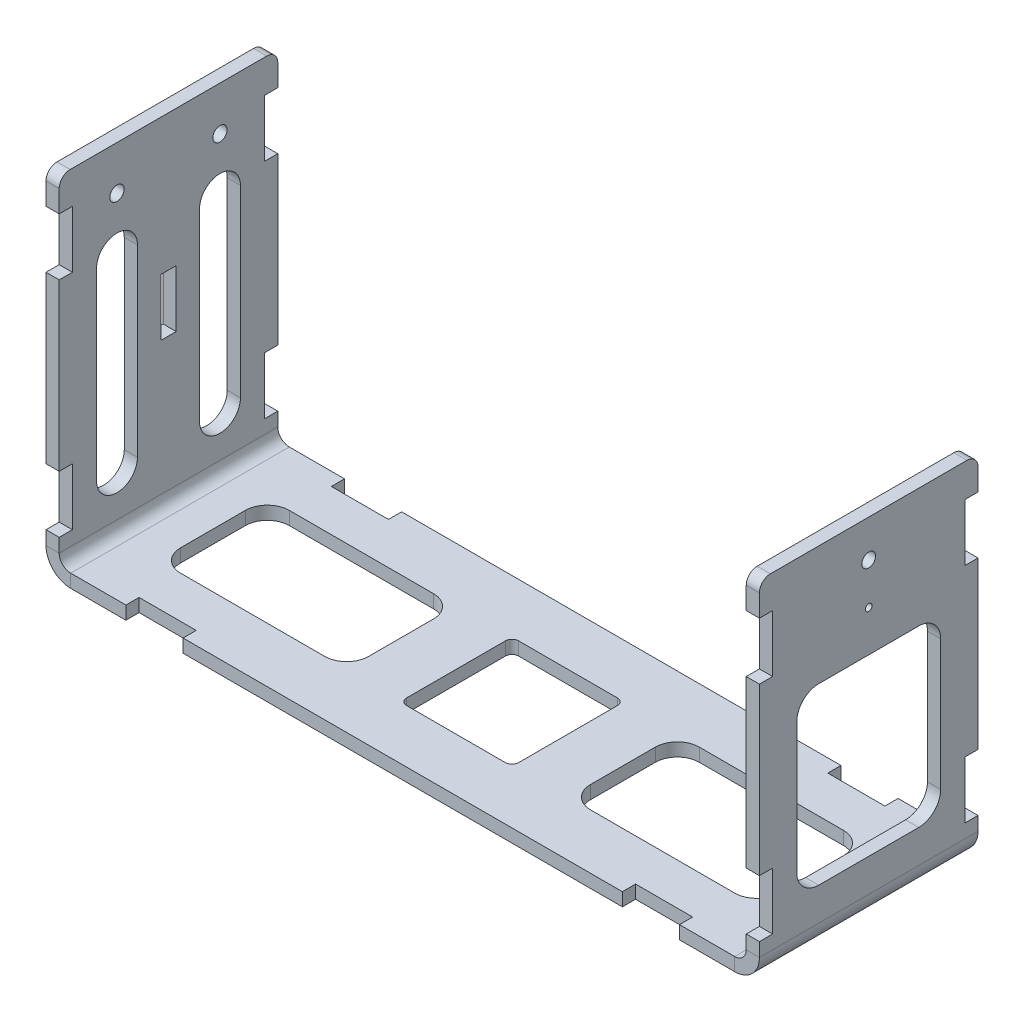
from build123d import *

# Parameters (mm, degrees)
BASE_FLANGE1_DEPTH      = 25.273
CUT_EXTRUDE1_DEPTH      = 117.462097169
CUT_EXTRUDE1_DEPTH_BACK = 117.462097169
SKETCH6_W               = 13.208
SKETCH6_H               = 3.048
CUT_EXTRUDE2_DEPTH      = 182.604935466
CUT_EXTRUDE2_DEPTH_BACK = 182.604935466
SKETCH7_W               = 3.048
SKETCH7_H               = 13.208
FILLET1_R               = 2.54
SKETCH9_R               = 1.5875
SKETCH9_R_2             = 0.7747
CUT_EXTRUDE4_DEPTH      = 182.604935466
CUT_EXTRUDE5_REACH      = 186.328
SKETCH10_R              = 1.651
CUT_EXTRUDE6_REACH      = 186.328
SKETCH11_W              = 3.556
SKETCH11_H              = 13.208
CUT_EXTRUDE8_REACH      = 120.531
SKETCH15_W              = 43.500088515
SKETCH15_H              = 25.146
FILLET2_R               = 5.08
CUT_EXTRUDE9_REACH      = 186.328
CUT_EXTRUDE12_REACH     = 186.328
SKETCH21_W              = 33.274
SKETCH21_H              = 40.343404573
FILLET4_R               = 5.08


# Sheet-metal steps are written as plain solids
with BuildPart() as part:
    # Sketch1 → Base-Flange1 (new, symmetric)
    with BuildSketch(Plane.XY):
        with BuildLine():
            Line((79.441088515, 78.232), (79.441088515, 2.667))
            ThreePointArc((79.441088515, 2.667), (78.6599423, 0.781146215), (76.774088515, 0))
            Line((76.774088515, 0), (-76.774088515, 0))
            ThreePointArc((-76.774088515, 0), (-78.6599423, 0.781146215), (-79.441088515, 2.667))
            Line((-79.441088515, 2.667), (-79.441088515, 78.232))
            Line((-79.441088515, 78.232), (-82.489088515, 78.232))
            Line((-82.489088515, 78.232), (-82.489088515, 2.667))
            ThreePointArc((-82.489088515, 2.667), (-80.815203769, -1.374115254), (-76.774088515, -3.048))
            Line((-76.774088515, -3.048), (76.774088515, -3.048))
            ThreePointArc((76.774088515, -3.048), (80.815203769, -1.374115254), (82.489088515, 2.667))
            Line((82.489088515, 2.667), (82.489088515, 78.232))
            Line((82.489088515, 78.232), (79.441088515, 78.232))
        make_face()
    extrude(amount=BASE_FLANGE1_DEPTH, both=True)

    # Sketch6 → Cut-Extrude1 (cut, two sides: drawn at the far end of the back side and taken through both)
    with BuildSketch(Plane(origin=(0, 0, 0), x_dir=(1, 0, 0), z_dir=(0, 1, 0)).offset(-CUT_EXTRUDE1_DEPTH_BACK)):
        with Locations((-57.404, 23.749)):
            Rectangle(SKETCH6_W, SKETCH6_H)
        with Locations((-57.404, -23.749)):
            Rectangle(SKETCH6_W, SKETCH6_H)
        with Locations((57.404, -23.749)):
            Rectangle(SKETCH6_W, SKETCH6_H)
        with Locations((57.404, 23.749)):
            Rectangle(SKETCH6_W, SKETCH6_H)
    extrude(amount=CUT_EXTRUDE1_DEPTH + CUT_EXTRUDE1_DEPTH_BACK, mode=Mode.SUBTRACT)

    # Sketch7 → Cut-Extrude2 (cut, two sides: drawn at the far end of the back side and taken through both)
    with BuildSketch(Plane(origin=(-79.441088515, 0, 0), x_dir=(0, 0, -1), z_dir=(1, 0, 0)).offset(-CUT_EXTRUDE2_DEPTH_BACK)):
        with Locations((-23.749, 12.446)):
            Rectangle(SKETCH7_W, SKETCH7_H)
        with Locations((23.749, 12.446)):
            Rectangle(SKETCH7_W, SKETCH7_H)
        with Locations((23.749, 64.008)):
            Rectangle(SKETCH7_W, SKETCH7_H)
        with Locations((-23.749, 64.008)):
            Rectangle(SKETCH7_W, SKETCH7_H)
    extrude(amount=CUT_EXTRUDE2_DEPTH + CUT_EXTRUDE2_DEPTH_BACK, mode=Mode.SUBTRACT)

    # Fillet1
    fillet1_edges = [part.edges().sort_by_distance(p)[0] for p in [
        (80.965088515, 78.232, -25.273),
        (-80.965088515, 78.232, -25.273),
        (80.965088515, 78.232, 25.273),
        (-80.965088515, 78.232, 25.273),
    ]]
    fillet(fillet1_edges, radius=FILLET1_R)

    # Sketch9 → Cut-Extrude4 (cut, through all)
    with BuildSketch(Plane.ZY.offset(-79.441088515)):
        with Locations(Location((0, 69.638595427, 0), (0, 0, 270))):
            Circle(SKETCH9_R)
        with Locations(Location((0, 60.113595427, 0), (0, 0, 270))):
            Circle(SKETCH9_R_2)
    extrude(amount=-CUT_EXTRUDE4_DEPTH, mode=Mode.SUBTRACT)

    # Sketch10 → Cut-Extrude5 (cut, up to next)
    with BuildSketch(Plane.ZY.offset(82.489088515), mode=Mode.PRIVATE) as cut_extrude5_sk1:
        with Locations(Location((11.90625, 68.072, 0), (0, 0, 270))):
            Circle(SKETCH10_R)
    cut_extrude5_tool1 = extrude(cut_extrude5_sk1.sketch, amount=-CUT_EXTRUDE5_REACH, mode=Mode.PRIVATE) & part.part
    # Sketch10 → Cut-Extrude5 (cut, up to next)
    with BuildSketch(Plane.ZY.offset(82.489088515), mode=Mode.PRIVATE) as cut_extrude5_sk2:
        with Locations(Location((-11.90625, 68.072, 0), (0, 0, 270))):
            Circle(SKETCH10_R)
    cut_extrude5_tool2 = extrude(cut_extrude5_sk2.sketch, amount=-CUT_EXTRUDE5_REACH, mode=Mode.PRIVATE) & part.part
    add(cut_extrude5_tool1.solids().sort_by_distance((-82.489089, 68.072, 11.90625))[0], mode=Mode.SUBTRACT)
    add(cut_extrude5_tool2.solids().sort_by_distance((-82.489089, 68.072, -11.90625))[0], mode=Mode.SUBTRACT)

    # Sketch11 → Cut-Extrude6 (cut, up to next)
    with BuildSketch(Plane.ZY.offset(82.489088515), mode=Mode.PRIVATE) as cut_extrude6_sk1:
        with Locations((0, 40.132)):
            Rectangle(SKETCH11_W, SKETCH11_H)
    cut_extrude6_tool1 = extrude(cut_extrude6_sk1.sketch, amount=-CUT_EXTRUDE6_REACH, mode=Mode.PRIVATE) & part.part
    add(cut_extrude6_tool1.solids().sort_by_distance((-82.489089, 40.132, 0))[0], mode=Mode.SUBTRACT)

    # Sketch15 → Cut-Extrude8 (cut, up to next)
    with BuildSketch(Plane.XZ.offset(3.048), mode=Mode.PRIVATE) as cut_extrude8_sk1:
        with Locations((-47.404044257, 0)):
            Rectangle(SKETCH15_W, SKETCH15_H)
    cut_extrude8_tool1 = extrude(cut_extrude8_sk1.sketch, amount=-CUT_EXTRUDE8_REACH, mode=Mode.PRIVATE) & part.part
    # Sketch15 → Cut-Extrude8 (cut, up to next)
    with BuildSketch(Plane.XZ.offset(3.048), mode=Mode.PRIVATE) as cut_extrude8_sk2:
        with Locations((47.404044257, 0)):
            Rectangle(SKETCH15_W, SKETCH15_H)
    cut_extrude8_tool2 = extrude(cut_extrude8_sk2.sketch, amount=-CUT_EXTRUDE8_REACH, mode=Mode.PRIVATE) & part.part
    # Sketch15 → Cut-Extrude8 (cut, up to next)
    with BuildSketch(Plane.XZ.offset(3.048), mode=Mode.PRIVATE) as cut_extrude8_sk3:
        with BuildLine():
            Line((12.954, -11.43), (12.954, 11.43))
            ThreePointArc((12.954, 11.43), (12.507630735, 12.507630735), (11.43, 12.954))
            Line((11.43, 12.954), (-11.43, 12.954))
            ThreePointArc((-11.43, 12.954), (-12.507630735, 12.507630735), (-12.954, 11.43))
            Line((-12.954, 11.43), (-12.954, -11.43))
            ThreePointArc((-12.954, -11.43), (-12.507630735, -12.507630735), (-11.43, -12.954))
            Line((-11.43, -12.954), (11.43, -12.954))
            ThreePointArc((11.43, -12.954), (12.507630735, -12.507630735), (12.954, -11.43))
        make_face()
    cut_extrude8_tool3 = extrude(cut_extrude8_sk3.sketch, amount=-CUT_EXTRUDE8_REACH, mode=Mode.PRIVATE) & part.part
    add(cut_extrude8_tool1.solids().sort_by_distance((-47.404044, -3.048, 0))[0], mode=Mode.SUBTRACT)
    add(cut_extrude8_tool2.solids().sort_by_distance((47.404044, -3.048, 0))[0], mode=Mode.SUBTRACT)
    add(cut_extrude8_tool3.solids().sort_by_distance((0, -3.048, 0))[0], mode=Mode.SUBTRACT)

    # Fillet2
    fillet2_edges = [part.edges().sort_by_distance(p)[0] for p in [
        (-69.154088515, -1.524, -12.573),
        (-69.154088515, -1.524, 12.573),
        (-25.654, -1.524, 12.573),
        (-25.654, -1.524, -12.573),
        (25.654, -1.524, 12.573),
        (69.154088515, -1.524, 12.573),
        (69.154088515, -1.524, -12.573),
        (25.654, -1.524, -12.573),
    ]]
    fillet(fillet2_edges, radius=FILLET2_R)

    # Sketch17 → Cut-Extrude9 (cut, up to next)
    with BuildSketch(Plane.ZY.offset(82.489088515), mode=Mode.PRIVATE) as cut_extrude9_sk1:
        with BuildLine():
            Line((-7.1755, 55.372), (-7.1755, 12.827))
            ThreePointArc((-7.1755, 12.827), (-11.90625, 8.09625), (-16.637, 12.827))
            Line((-16.637, 12.827), (-16.637, 55.372))
            ThreePointArc((-16.637, 55.372), (-11.90625, 60.10275), (-7.1755, 55.372))
        make_face()
    cut_extrude9_tool1 = extrude(cut_extrude9_sk1.sketch, amount=-CUT_EXTRUDE9_REACH, mode=Mode.PRIVATE) & part.part
    # Sketch17 → Cut-Extrude9 (cut, up to next)
    with BuildSketch(Plane.ZY.offset(82.489088515), mode=Mode.PRIVATE) as cut_extrude9_sk2:
        with BuildLine():
            Line((7.1755, 55.372), (7.1755, 12.827))
            ThreePointArc((7.1755, 12.827), (11.90625, 8.09625), (16.637, 12.827))
            Line((16.637, 12.827), (16.637, 55.372))
            ThreePointArc((16.637, 55.372), (11.90625, 60.10275), (7.1755, 55.372))
        make_face()
    cut_extrude9_tool2 = extrude(cut_extrude9_sk2.sketch, amount=-CUT_EXTRUDE9_REACH, mode=Mode.PRIVATE) & part.part
    add(cut_extrude9_tool1.solids().sort_by_distance((-82.489089, 34.0995, -11.90625))[0], mode=Mode.SUBTRACT)
    add(cut_extrude9_tool2.solids().sort_by_distance((-82.489089, 34.0995, 11.90625))[0], mode=Mode.SUBTRACT)

    # Sketch21 → Cut-Extrude12 (cut, up to next)
    with BuildSketch(Plane(origin=(82.489088515, 0, 0), x_dir=(0, 0, -1), z_dir=(1, 0, 0)), mode=Mode.PRIVATE) as cut_extrude12_sk1:
        with Locations((0, 30.458702286)):
            Rectangle(SKETCH21_W, SKETCH21_H)
    cut_extrude12_tool1 = extrude(cut_extrude12_sk1.sketch, amount=-CUT_EXTRUDE12_REACH, mode=Mode.PRIVATE) & part.part
    add(cut_extrude12_tool1.solids().sort_by_distance((82.489089, 30.458702, 0))[0], mode=Mode.SUBTRACT)

    # Fillet4
    fillet4_edges = [part.edges().sort_by_distance(p)[0] for p in [
        (80.965088515, 50.630404573, -16.637),
        (80.965088515, 10.287, -16.637),
        (80.965088515, 10.287, 16.637),
        (80.965088515, 50.630404573, 16.637),
    ]]
    fillet(fillet4_edges, radius=FILLET4_R)


solid = part.part
